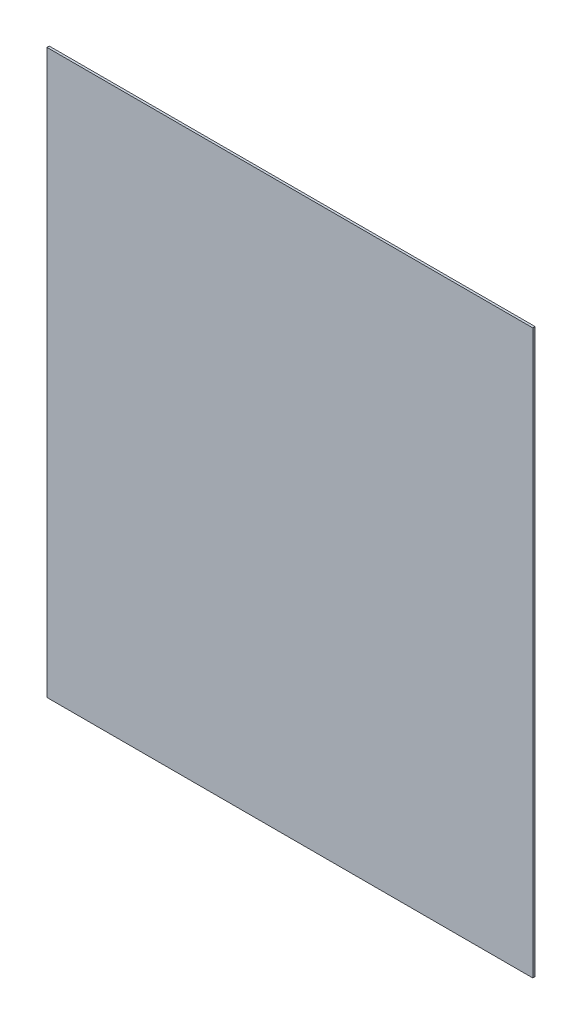
from build123d import *

# Parameters (mm, degrees)
SKETCH2_W           = 315
SKETCH2_H           = 365
BOSS_EXTRUDE2_DEPTH = 1.5


with BuildPart() as part:
    # Sketch2 → Boss-Extrude2 (new body)
    with BuildSketch(Plane.XY):
        with Locations((2.5, 0)):
            Rectangle(SKETCH2_W, SKETCH2_H)
    extrude(amount=BOSS_EXTRUDE2_DEPTH)


solid = part.part
